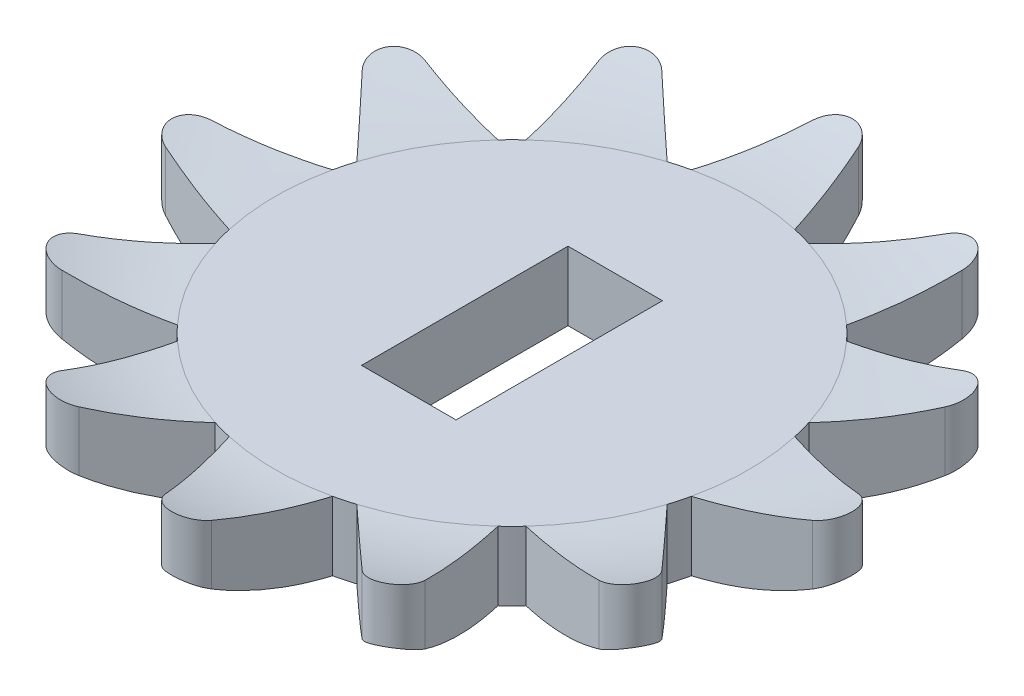
from build123d import *

# Parameters (mm, degrees)
BOSS_EXTRUDE1_DEPTH = 2.45
SKETCH8_W           = 2.7432
SKETCH8_H           = 5.9944
CUT_EXTRUDE1_DEPTH  = 10


with BuildPart() as part:
    # Sketch1 → Boss-Extrude1 (new body)
    with BuildSketch(Plane(origin=(0, 0, 0), x_dir=(1, 0, 0), z_dir=(0, 1, 0))):
        with BuildLine():
            Line((1.5, 6.70936845), (0.668522477, 9.387551675))
            ThreePointArc((0.668522477, 9.387551675), (0, 9.88), (-0.668522477, 9.387551675))
            Line((-0.668522477, 9.387551675), (-1.5, 6.70936845))
            ThreePointArc((-1.5, 6.70936845), (-1.779380935, 6.640740056), (-2.055646119, 6.560483521))
            Line((-2.055646119, 6.560483521), (-4.114818389, 8.464119468))
            ThreePointArc((-4.114818389, 8.464119468), (-4.94, 8.556330989), (-5.272733285, 7.795596991))
            Line((-5.272733285, 7.795596991), (-4.653722331, 5.060483521))
            ThreePointArc((-4.653722331, 5.060483521), (-4.861359121, 4.861359121), (-5.060483521, 4.653722331))
            Line((-5.060483521, 4.653722331), (-7.795596991, 5.272733285))
            ThreePointArc((-7.795596991, 5.272733285), (-8.556330989, 4.94), (-8.464119468, 4.114818389))
            Line((-8.464119468, 4.114818389), (-6.560483521, 2.055646119))
            ThreePointArc((-6.560483521, 2.055646119), (-6.640740056, 1.779380935), (-6.70936845, 1.5))
            Line((-6.70936845, 1.5), (-9.387551675, 0.668522477))
            ThreePointArc((-9.387551675, 0.668522477), (-9.88, 0), (-9.387551675, -0.668522477))
            Line((-9.387551675, -0.668522477), (-6.70936845, -1.5))
            ThreePointArc((-6.70936845, -1.5), (-6.640740056, -1.779380935), (-6.560483521, -2.055646119))
            Line((-6.560483521, -2.055646119), (-8.464119468, -4.114818389))
            ThreePointArc((-8.464119468, -4.114818389), (-8.556330989, -4.94), (-7.795596991, -5.272733285))
            Line((-7.795596991, -5.272733285), (-5.060483521, -4.653722331))
            ThreePointArc((-5.060483521, -4.653722331), (-4.861359121, -4.861359121), (-4.653722331, -5.060483521))
            Line((-4.653722331, -5.060483521), (-5.272733285, -7.795596991))
            ThreePointArc((-5.272733285, -7.795596991), (-4.94, -8.556330989), (-4.114818389, -8.464119468))
            Line((-4.114818389, -8.464119468), (-2.055646119, -6.560483521))
            ThreePointArc((-2.055646119, -6.560483521), (-1.779380935, -6.640740056), (-1.5, -6.70936845))
            Line((-1.5, -6.70936845), (-0.668522477, -9.387551675))
            ThreePointArc((-0.668522477, -9.387551675), (0, -9.88), (0.668522477, -9.387551675))
            Line((0.668522477, -9.387551675), (1.5, -6.70936845))
            ThreePointArc((1.5, -6.70936845), (1.779380935, -6.640740056), (2.055646119, -6.560483521))
            Line((2.055646119, -6.560483521), (4.114818389, -8.464119468))
            ThreePointArc((4.114818389, -8.464119468), (4.94, -8.556330989), (5.272733285, -7.795596991))
            Line((5.272733285, -7.795596991), (4.653722331, -5.060483521))
            ThreePointArc((4.653722331, -5.060483521), (4.861359121, -4.861359121), (5.060483521, -4.653722331))
            Line((5.060483521, -4.653722331), (7.795596991, -5.272733285))
            ThreePointArc((7.795596991, -5.272733285), (8.556330989, -4.94), (8.464119468, -4.114818389))
            Line((8.464119468, -4.114818389), (6.560483521, -2.055646119))
            ThreePointArc((6.560483521, -2.055646119), (6.640740056, -1.779380935), (6.70936845, -1.5))
            Line((6.70936845, -1.5), (9.387551675, -0.668522477))
            ThreePointArc((9.387551675, -0.668522477), (9.88, 0), (9.387551675, 0.668522477))
            Line((9.387551675, 0.668522477), (6.70936845, 1.5))
            ThreePointArc((6.70936845, 1.5), (6.640740056, 1.779380935), (6.560483521, 2.055646119))
            Line((6.560483521, 2.055646119), (8.464119468, 4.114818389))
            ThreePointArc((8.464119468, 4.114818389), (8.556330989, 4.94), (7.795596991, 5.272733285))
            Line((7.795596991, 5.272733285), (5.060483521, 4.653722331))
            ThreePointArc((5.060483521, 4.653722331), (4.861359121, 4.861359121), (4.653722331, 5.060483521))
            Line((4.653722331, 5.060483521), (5.272733285, 7.795596991))
            ThreePointArc((5.272733285, 7.795596991), (4.94, 8.556330989), (4.114818389, 8.464119468))
            Line((4.114818389, 8.464119468), (2.055646119, 6.560483521))
            ThreePointArc((2.055646119, 6.560483521), (1.779380935, 6.640740056), (1.5, 6.70936845))
        make_face()
    extrude(amount=BOSS_EXTRUDE1_DEPTH)

    # Sketch7 → Cut-Revolve2 (revolve, cut)
    with BuildSketch(Plane.XY):
        with BuildLine():
            Line((0, 2), (0, 2.45))
            Line((0, 2.45), (-9.88, 2.45))
            ThreePointArc((-9.88, 2.45), (-8.394253517, 2.113123734), (-6.875, 2))
            Line((-6.875, 2), (0, 2))
        make_face()
        with BuildLine():
            Line((-9.88, 0), (-6.875, 0))
            ThreePointArc((-6.875, 0), (-8.436451648, 0.216588585), (-9.88, 0.85))
            Line((-9.88, 0.85), (-9.88, 0))
        make_face()
    revolve(axis=Axis((0, 0, 0), (0, 1, 0)), mode=Mode.SUBTRACT)

    # Sketch8 → Cut-Extrude1 (cut)
    with BuildSketch(Plane(origin=(0, 2, 0), x_dir=(1, 0, 0), z_dir=(0, 1, 0))):
        Rectangle(SKETCH8_W, SKETCH8_H)
    extrude(amount=-CUT_EXTRUDE1_DEPTH, mode=Mode.SUBTRACT)


solid = part.part
